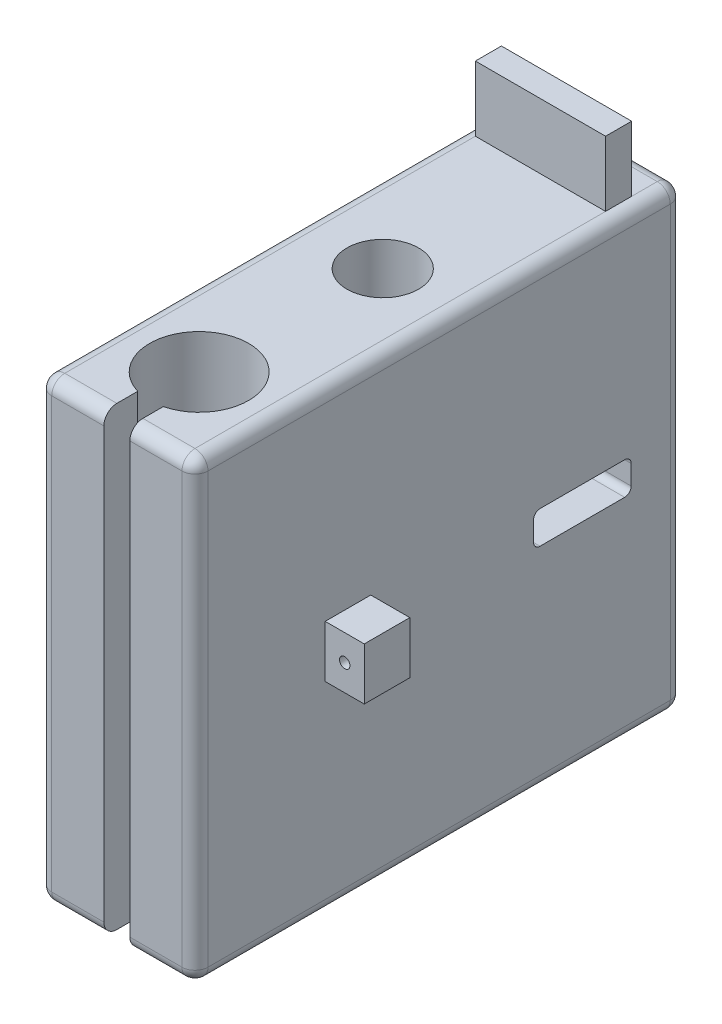
from build123d import *

# Parameters (mm, degrees)
RESSALTO_EXTRUS_O1_DEPTH                   = 12
RESSALTO_EXTRUS_O1_DEPTH_BACK              = 12
ESBO_O1_W                                  = 75
ESBO_O1_H                                  = 70
ESBO_O3_R                                  = 5.5
CORTE_EXTRUS_O1_DEPTH                      = 525.799189678
ESBO_O4_R                                  = 4.1
CORTE_EXTRUS_O2_DEPTH                      = 20
FILETE1_R                                  = 2
CORTE_EXTRUS_O3_DEPTH                      = 29
CORTE_EXTRUS_O4_DEPTH                      = 28
RESSALTO_EXTRUS_O2_DEPTH                   = 6
RESSALTO_EXTRUS_O2_DEPTH_BACK              = 30
ESBO_O7_W                                  = 7
ESBO_O7_H                                  = 8
BROCA_DE_ROSQUEAR_PARA_TARRAXA_DE_M2X0_4_D = 1.6
BROCA_DE_ROSQUEAR_PARA_TARRAXA_DE_M2_2_D   = 1.6
ESBO_O18_W                                 = 20
ESBO_O18_H                                 = 4
RESSALTO_EXTRUS_O3_DEPTH                   = 10


with BuildPart() as part:
    # Esboço1 → Ressalto-extrusão1 (new, two sides: drawn at the far end of the back side and taken through both)
    with BuildSketch(Plane(origin=(-220, 0, 0), x_dir=(0, 0, -1), z_dir=(1, 0, 0)).offset(-RESSALTO_EXTRUS_O1_DEPTH_BACK)):
        with Locations((-427.999935002, 213.253952806)):
            Rectangle(ESBO_O1_W, ESBO_O1_H)
    extrude(amount=RESSALTO_EXTRUS_O1_DEPTH + RESSALTO_EXTRUS_O1_DEPTH_BACK)

    # Esboço3 → Corte-extrusão1 (cut, through all)
    with BuildSketch(Plane(origin=(0, 248.253952806, 0), x_dir=(1, 0, 0), z_dir=(0, 1, 0))):
        with Locations((-219.508549322, -425.149935105)):
            Circle(ESBO_O3_R)
        with BuildLine():
            Line((-220, -465.499935002), (-218, -465.499935002))
            Line((-218, -465.499935002), (-218, -460.369179456))
            ThreePointArc((-218, -460.369179456), (-219.711945476, -445.401349285), (-222, -460.292000844))
            Line((-222, -460.292000844), (-222, -465.499935002))
            Line((-222, -465.499935002), (-220, -465.499935002))
        make_face()
    extrude(amount=-CORTE_EXTRUS_O1_DEPTH, mode=Mode.SUBTRACT)

    # Esboço4 → Corte-extrusão2 (cut)
    with BuildSketch(Plane(origin=(0, 0, 390.499935002), x_dir=(-1, 0, 0), z_dir=(0, 0, -1))):
        with Locations((219.858557552, 238.253952806)):
            Circle(ESBO_O4_R)
        with Locations((219.858557552, 188.253952806)):
            Circle(ESBO_O4_R)
    extrude(amount=-CORTE_EXTRUS_O2_DEPTH, mode=Mode.SUBTRACT)

    # Filete1
    filete1_edges = [part.edges().sort_by_distance(p)[0] for p in [
        (-227, 178.253952806, 465.499935002),
        (-213, 178.253952806, 465.499935002),
        (-213, 248.253952806, 465.499935002),
        (-227, 248.253952806, 465.499935002),
        (-208, 178.253952806, 427.999935002),
        (-208, 248.253952806, 427.999935002),
        (-208, 213.253952806, 465.499935002),
        (-232, 178.253952806, 427.999935002),
        (-232, 213.253952806, 465.499935002),
        (-232, 248.253952806, 427.999935002),
        (-220, 248.253952806, 390.499935002),
        (-220, 178.253952806, 390.499935002),
        (-208, 213.253952806, 390.499935002),
        (-232, 213.253952806, 390.499935002),
    ]]
    fillet(filete1_edges, radius=FILETE1_R)

    # Esboço5 → Corte-extrusão3 (cut)
    with BuildSketch(Plane(origin=(0, 0, 390.499935002), x_dir=(-1, 0, 0), z_dir=(0, 0, -1))):
        Polygon((214.012346474, 195.258527076), (226.012342444, 195.248692869), (226.041845065, 231.24868078), (214.041849094, 231.258514987), align=None)
    extrude(amount=-CORTE_EXTRUS_O3_DEPTH, mode=Mode.SUBTRACT)

    # Esboço6 → Corte-extrusão4 (cut)
    with BuildSketch(Plane.ZY.offset(232)):
        with BuildLine():
            Line((399.499935002, 215.753952806), (412.499935002, 215.753952806))
            ThreePointArc((412.499935002, 215.753952806), (413.207041783, 215.461059587), (413.499935002, 214.753952806))
            Line((413.499935002, 214.753952806), (413.499935002, 211.753952806))
            ThreePointArc((413.499935002, 211.753952806), (413.207041783, 211.046846025), (412.499935002, 210.753952806))
            Line((412.499935002, 210.753952806), (399.499935002, 210.753952806))
            ThreePointArc((399.499935002, 210.753952806), (398.792828221, 211.046846025), (398.499935002, 211.753952806))
            Line((398.499935002, 211.753952806), (398.499935002, 214.753952806))
            ThreePointArc((398.499935002, 214.753952806), (398.792828221, 215.461059587), (399.499935002, 215.753952806))
        make_face()
    extrude(amount=-CORTE_EXTRUS_O4_DEPTH, mode=Mode.SUBTRACT)

    # Esboço7 → Ressalto-extrusão2 (add, two sides: drawn at the far end of the back side and taken through both)
    with BuildSketch(Plane(origin=(-208, 0, 0), x_dir=(0, 0, -1), z_dir=(1, 0, 0)).offset(-RESSALTO_EXTRUS_O2_DEPTH_BACK)):
        with Locations((-441.999935002, 213.253952806)):
            Rectangle(ESBO_O7_W, ESBO_O7_H)
    extrude(amount=RESSALTO_EXTRUS_O2_DEPTH + RESSALTO_EXTRUS_O2_DEPTH_BACK)

    # Broca de rosquear para tarraxa de M2x0.4 (through all)
    with Locations(Plane.XY.offset(445.499935002)):
        with Locations((-205, 213.253952806)):
            Hole(BROCA_DE_ROSQUEAR_PARA_TARRAXA_DE_M2X0_4_D / 2)

    # Broca de rosquear para tarraxa de M2 2 (through all)
    with Locations(Plane.XY.offset(445.499935002)):
        with Locations((-235, 213.253952806)):
            Hole(BROCA_DE_ROSQUEAR_PARA_TARRAXA_DE_M2_2_D / 2)

    # Esboço18 → Ressalto-extrusão3 (add)
    with BuildSketch(Plane(origin=(0, 248.253952806, 0), x_dir=(1, 0, 0), z_dir=(0, 1, 0))):
        with Locations((-220, -398.434558943)):
            Rectangle(ESBO_O18_W, ESBO_O18_H)
    extrude(amount=RESSALTO_EXTRUS_O3_DEPTH)


solid = part.part
